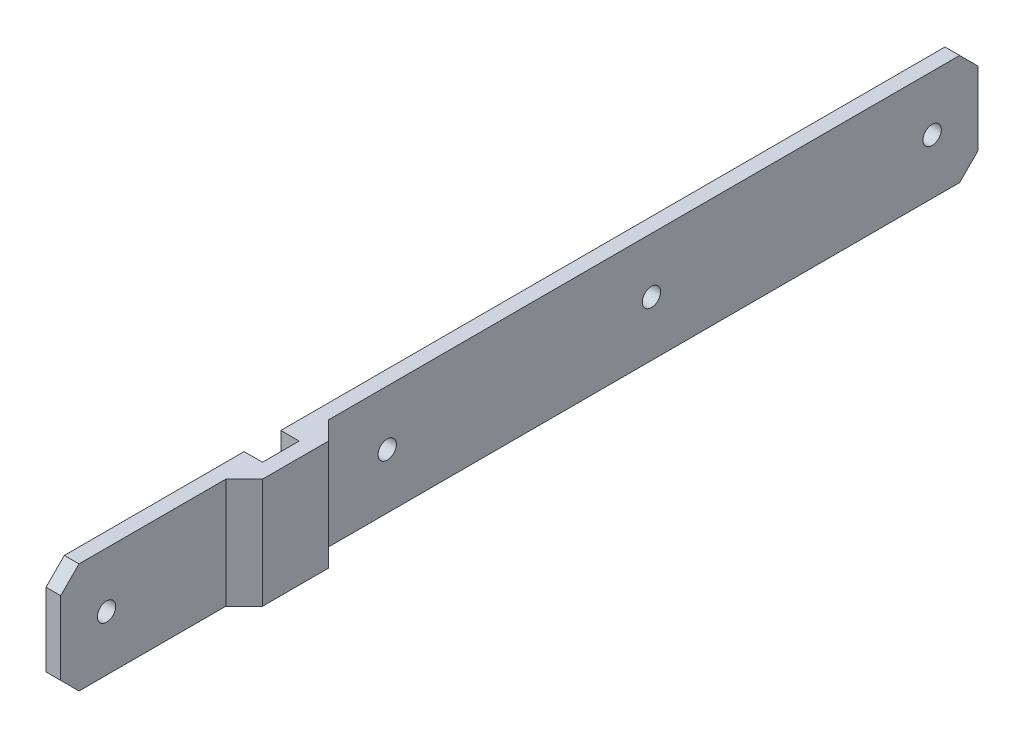
from build123d import *

# Parameters (mm, degrees)
SALIENTE_EXTRUIR1_DEPTH = 15
CROQUIS2_R              = 2.5
CORTAR_EXTRUIR2_DEPTH   = 30
CHAFL_N1_SIZE           = 5


with BuildPart() as part:
    # Croquis1 → Saliente-Extruir1 (new, symmetric)
    with BuildSketch(Plane(origin=(0, 0, 0), x_dir=(1, 0, 0), z_dir=(0, 1, 0))):
        Polygon((0, 0), (0, 186), (4, 186), (4, 4), (9, 4), (9, -14), (4, -14), (4, -64), (0, -64), (0, -10), (5, -10), (5, 0), align=None)
    extrude(amount=SALIENTE_EXTRUIR1_DEPTH, both=True)

    # Croquis2 → Cortar-Extruir2 (cut)
    with BuildSketch(Plane(origin=(0, 0, 0), x_dir=(0, 0, -1), z_dir=(1, 0, 0))):
        with Locations(Location((-51.5, 0, 0), (0, 0, 180))):
            Circle(CROQUIS2_R)
        with Locations(Location((25, 0, 0), (0, 0, 180))):
            Circle(CROQUIS2_R)
        with Locations(Location((97, 0, 0), (0, 0, 180))):
            Circle(CROQUIS2_R)
        with Locations(Location((173.5, 0, 0), (0, 0, 180))):
            Circle(CROQUIS2_R)
    extrude(amount=CORTAR_EXTRUIR2_DEPTH, mode=Mode.SUBTRACT)

    # Chaflán1
    chafl_n1_edges = [part.edges().sort_by_distance(p)[0] for p in [
        (2, -15, -186),
        (2, 15, -186),
        (2, -15, 64),
        (2, 15, 64),
        (4, 0, -4),
        (4, 0, 14),
    ]]
    chamfer(chafl_n1_edges, length=CHAFL_N1_SIZE - 0.0001)  # a hair under: the kernel refuses the full size


solid = part.part
